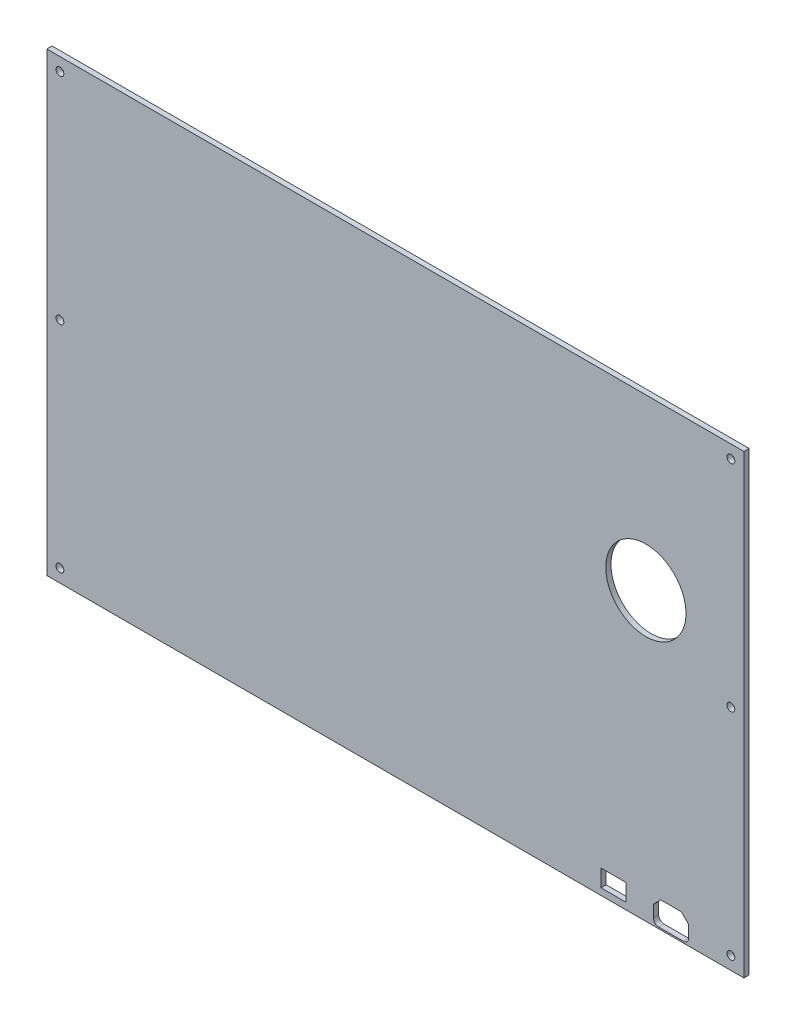
from build123d import *

# Parameters (mm, degrees)
SKICA1_W                 = 535
SKICA1_H                 = 350
SKICA1_R                 = 3
P_IDAT_VYSUNUT_M1_DEPTH  = 4
SKICA2_R                 = 30.776653742
ODEBRAT_VYSUNUT_M1_DEPTH = 4
SKICA3_W                 = 19.15
SKICA3_H                 = 13.11
ODEBRAT_VYSUNUT_M2_DEPTH = 4


with BuildPart() as part:
    # Skica1 → Přidat vysunutím1 (new body)
    with BuildSketch(Plane.XY):
        Rectangle(SKICA1_W, SKICA1_H)
        with Locations((-257.5, 165)):
            Circle(SKICA1_R, mode=Mode.SUBTRACT)
        with Locations((-257.5, 0)):
            Circle(SKICA1_R, mode=Mode.SUBTRACT)
        with Locations((-257.5, -165)):
            Circle(SKICA1_R, mode=Mode.SUBTRACT)
        with Locations((257.5, 165)):
            Circle(SKICA1_R, mode=Mode.SUBTRACT)
        with Locations((257.5, 0)):
            Circle(SKICA1_R, mode=Mode.SUBTRACT)
        with Locations((257.5, -165)):
            Circle(SKICA1_R, mode=Mode.SUBTRACT)
    extrude(amount=P_IDAT_VYSUNUT_M1_DEPTH)

    # Skica2 → Odebrat vysunutím1 (cut)
    with BuildSketch(Plane(origin=(0, 0, 0), x_dir=(-1, 0, 0), z_dir=(0, 0, -1))):
        with Locations((-192.248320425, 45.04602447)):
            Circle(SKICA2_R)
    extrude(amount=-ODEBRAT_VYSUNUT_M1_DEPTH, mode=Mode.SUBTRACT)

    # Skica3 → Odebrat vysunutím2 (cut)
    with BuildSketch(Plane.XY.offset(4)):
        with Locations((167.389589345, -163.335)):
            Rectangle(SKICA3_W, SKICA3_H)
        with BuildLine():
            Line((219.257482564, -155), (203.871696126, -155))
            ThreePointArc((203.871696126, -155), (203.68035441, -155.038060234), (203.518142735, -155.146446609))
            Line((203.518142735, -155.146446609), (198.211035954, -160.453553391))
            ThreePointArc((198.211035954, -160.453553391), (198.102649579, -160.615765065), (198.064589345, -160.807106781))
            Line((198.064589345, -160.807106781), (198.064589345, -169.8))
            ThreePointArc((198.064589345, -169.8), (199.23616222, -172.628427125), (202.064589345, -173.8))
            Line((202.064589345, -173.8), (221.064589345, -173.8))
            ThreePointArc((221.064589345, -173.8), (223.89301647, -172.628427125), (225.064589345, -169.8))
            Line((225.064589345, -169.8), (225.064589345, -160.807106781))
            ThreePointArc((225.064589345, -160.807106781), (225.026529111, -160.615765065), (224.918142735, -160.453553391))
            Line((224.918142735, -160.453553391), (219.611035954, -155.146446609))
            ThreePointArc((219.611035954, -155.146446609), (219.44882428, -155.038060234), (219.257482564, -155))
        make_face()
    extrude(amount=-ODEBRAT_VYSUNUT_M2_DEPTH, mode=Mode.SUBTRACT)


solid = part.part
